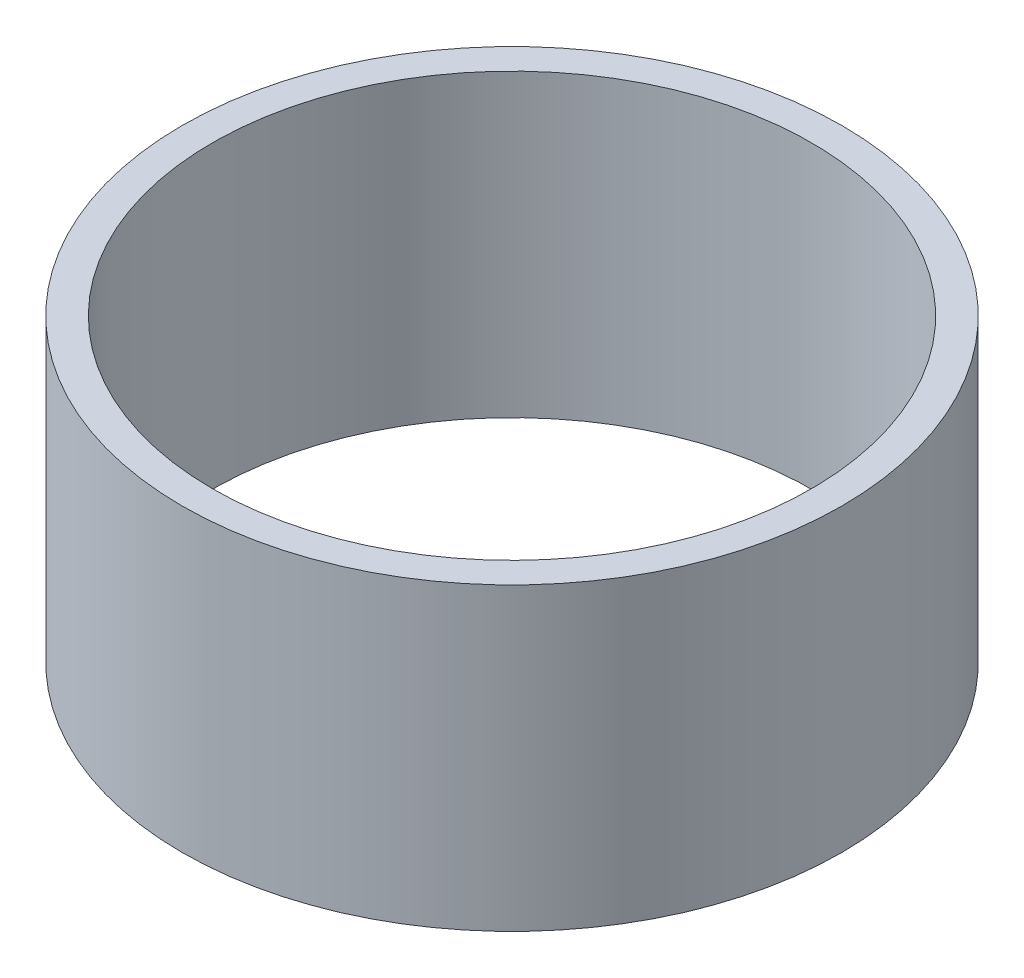
from build123d import *

# Parameters (mm, degrees)
SKETCH1_R           = 57.5
BOSS_EXTRUDE1_DEPTH = 52.335469436
SKETCH2_R           = 52.247625182
CUT_EXTRUDE1_DEPTH  = 97.703161071


with BuildPart() as part:
    # Sketch1 → Boss-Extrude1 (new body)
    with BuildSketch(Plane(origin=(0, 0, 0), x_dir=(1, 0, 0), z_dir=(0, 1, 0))):
        Circle(SKETCH1_R)
    extrude(amount=BOSS_EXTRUDE1_DEPTH)

    # Sketch2 → Cut-Extrude1 (cut, through all)
    with BuildSketch(Plane(origin=(0, 0, 0), x_dir=(1, 0, 0), z_dir=(0, 1, 0))):
        Circle(SKETCH2_R)
    extrude(amount=CUT_EXTRUDE1_DEPTH, mode=Mode.SUBTRACT)


solid = part.part
